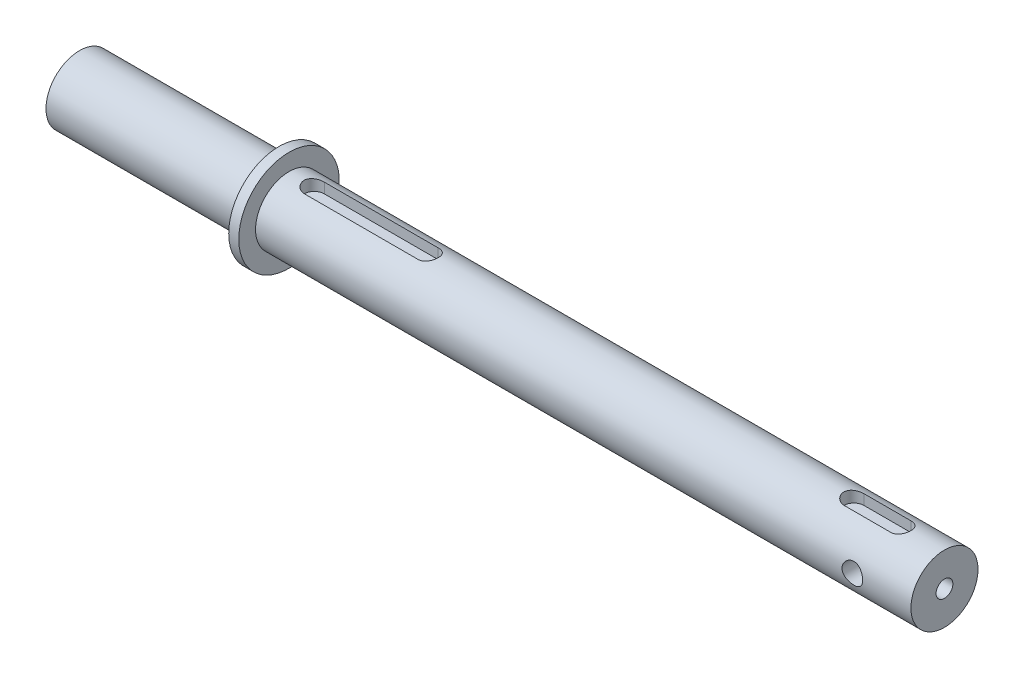
from build123d import *

# Parameters (mm, degrees)
SALIENTE_EXTRUIR1_START           = 8
CROQUIS1_R                        = 10
SALIENTE_EXTRUIR1_DEPTH           = 258
CROQUIS2_R                        = 15
SALIENTE_EXTRUIR2_DEPTH           = 3
CORTAR_EXTRUIR1_REACH             = 268.845
CROQUIS3_R                        = 3.075
CORTAR_EXTRUIR1_DIRECTION_2_REACH = 268.845
CORTAR_EXTRUIR2_START             = 10
CORTAR_EXTRUIR2_DEPTH             = 3.5
TALADRO_ROSCADO_M61_D             = 5
TALADRO_ROSCADO_M61_DEPTH         = 11.497848452
TALADRO_ROSCADO_M61_TIP           = 1.502151548
CORTAR_EXTRUIR3_START             = 10
CORTAR_EXTRUIR3_DEPTH             = 3.5


with BuildPart() as part:
    # Croquis1 → Saliente-Extruir1 (new body)
    with BuildSketch(Plane(origin=(0, 0, 0), x_dir=(0, 0, -1), z_dir=(1, 0, 0)).offset(SALIENTE_EXTRUIR1_START)):
        Circle(CROQUIS1_R)
    extrude(amount=SALIENTE_EXTRUIR1_DEPTH)

    # Croquis2 → Saliente-Extruir2 (add)
    with BuildSketch(Plane.ZY.offset(-70.5)):
        Circle(CROQUIS2_R)
    extrude(amount=SALIENTE_EXTRUIR2_DEPTH)

    # Croquis3 → Cortar-Extruir1 (cut, up to next)
    with BuildSketch(Plane.XY, mode=Mode.PRIVATE) as cortar_extruir1_sk1:
        with Locations((248.5, 0)):
            Circle(CROQUIS3_R)
    cortar_extruir1_tool1 = extrude(cortar_extruir1_sk1.sketch, amount=-CORTAR_EXTRUIR1_REACH, mode=Mode.PRIVATE) & part.part
    add(cortar_extruir1_tool1.solids().sort_by_distance((248.5, 0, 0))[0], mode=Mode.SUBTRACT)

    # Croquis3 → Cortar-Extruir1 direction 2 (cut, up to next)
    with BuildSketch(Plane.XY, mode=Mode.PRIVATE) as cortar_extruir1_direction_2_sk1:
        with Locations((248.5, 0)):
            Circle(CROQUIS3_R)
    cortar_extruir1_direction_2_tool1 = extrude(cortar_extruir1_direction_2_sk1.sketch, amount=CORTAR_EXTRUIR1_DIRECTION_2_REACH, mode=Mode.PRIVATE) & part.part
    add(cortar_extruir1_direction_2_tool1.solids().sort_by_distance((248.5, 0, 0))[0], mode=Mode.SUBTRACT)

    # Croquis4 → Cortar-Extruir2 (cut)
    with BuildSketch(Plane(origin=(0, 0, 0), x_dir=(1, 0, 0), z_dir=(0, 1, 0)).offset(CORTAR_EXTRUIR2_START)):
        with BuildLine():
            Line((239, 3), (253, 3))
            ThreePointArc((253, 3), (256, 0), (253, -3))
            Line((253, -3), (239, -3))
            ThreePointArc((239, -3), (236, 0), (239, 3))
        make_face()
    extrude(amount=-CORTAR_EXTRUIR2_DEPTH, mode=Mode.SUBTRACT)

    # Taladro roscado M61
    with Locations(Plane(origin=(266, 0, 0), x_dir=(0, 0, 1), z_dir=(1, 0, 0))):
        with Locations((0, 0)):
            Hole(TALADRO_ROSCADO_M61_D / 2, depth=TALADRO_ROSCADO_M61_DEPTH)
            with Locations((0, 0, -(TALADRO_ROSCADO_M61_DEPTH + TALADRO_ROSCADO_M61_TIP / 2))):  # 118° drill point
                Cone(0, TALADRO_ROSCADO_M61_D / 2, TALADRO_ROSCADO_M61_TIP, mode=Mode.SUBTRACT)

    # Croquis8 → Cortar-Extruir3 (cut)
    with BuildSketch(Plane(origin=(0, 0, 0), x_dir=(1, 0, 0), z_dir=(0, 1, 0)).offset(CORTAR_EXTRUIR3_START)):
        with BuildLine():
            Line((78, 3), (112, 3))
            ThreePointArc((112, 3), (115, 0), (112, -3))
            Line((112, -3), (78, -3))
            ThreePointArc((78, -3), (75, 0), (78, 3))
        make_face()
    extrude(amount=-CORTAR_EXTRUIR3_DEPTH, mode=Mode.SUBTRACT)


solid = part.part
